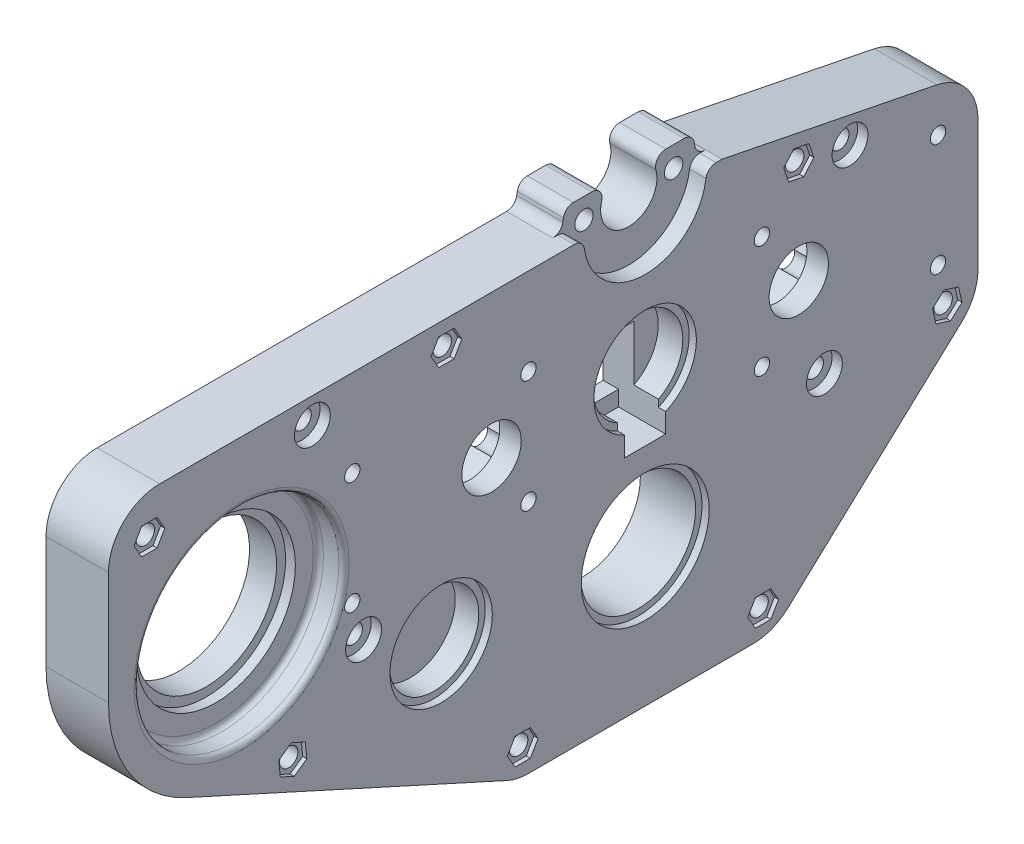
from build123d import *

# Parameters (mm, degrees)
SKETCH1_R             = 14.2875
SKETCH1_R_2           = 11.1125
SKETCH1_R_3           = 7.366
BOSS_EXTRUDE1_DEPTH   = 15.494
SKETCH2_R             = 15.875
SKETCH2_R_2           = 12.7
CUT_EXTRUDE1_DEPTH    = 1.778
CAVITY1_OUTLINE_R     = 7.366
CAVITY1_OUTLINE_R_2   = 4.445
CAVITY1_OUTLINE_R_3   = 1.143
CAVITY1_DEPTH         = 10.16
CAVITY1_START         = 10.16
CAVITY1_2_OUTLINE_R   = 4.445
CAVITY1_2_OUTLINE_R_2 = 1.143
CAVITY1_2_DEPTH       = 3.048
CAVITY1_START_2       = 12.192
CAVITY1_3_OUTLINE_R   = 1.905
CAVITY1_3_DEPTH       = 3.302
CAVITY1_4_DEPTH       = 1.778
CAVITY1_5_OUTLINE_R   = 2.286
CAVITY1_5_DEPTH       = 1.27
CAVITY1_START_3       = 13.208
CAVITY1_6_DEPTH       = 0.254
SKETCH3_R             = 11.1125
BOSS_EXTRUDE2_DEPTH   = 7.62
SKETCH5_R             = 15.24
CUT_EXTRUDE2_DEPTH    = 4.064
BOSS_EXTRUDE3_DEPTH   = 11.43
SKETCH7_R             = 2.286
SKETCH7_R_2           = 6.985
CUT_EXTRUDE3_DEPTH    = 115.652235041
FILLET1_R             = 2.54
FILLET2_R             = 2.54
CUT_EXTRUDE4_DEPTH    = 5.08
SKETCH9_R             = 17.4625
BOSS_EXTRUDE4_DEPTH   = 15.494
SKETCH11_R            = 19.685
CUT_EXTRUDE6_DEPTH    = 8.763
CUT_EXTRUDE7_DEPTH    = 156.43808204
SKETCH13_R            = 2.286
CUT_EXTRUDE8_DEPTH    = 156.43808204
CUT_EXTRUDE9_DEPTH    = 1.016
SKETCH15_R            = 4.445
CUT_EXTRUDE10_DEPTH   = 2.54
FILLET3_R             = 12.7
SKETCH17_R            = 25.4
CUT_EXTRUDE11_DEPTH   = 6.35
SKETCH18_R            = 11.1125
CUT_EXTRUDE12_DEPTH   = 7.62
SKETCH19_R            = 12.7
CUT_EXTRUDE13_DEPTH   = 1.778
FILLET4_R             = 1.27
SKETCH20_R            = 2.286
CUT_EXTRUDE14_DEPTH   = 156.43808204
SKETCH21_R            = 4.445
CUT_EXTRUDE15_DEPTH   = 2.54


# Read off the part's stored shape, not the designer's step: Cavity1
with BuildPart() as part:
    # Sketch1 → Boss-Extrude1 (new body)
    with BuildSketch(Plane(origin=(0, 0, 0), x_dir=(0, 0, -1), z_dir=(1, 0, 0))):
        Polygon((-82.55, 12.7), (-31.75, -34.29), (31.75, -34.29), (82.55, 12.7), (82.55, 73.66), (-82.55, 73.66), align=None)
        Circle(SKETCH1_R, mode=Mode.SUBTRACT)
        with Locations((0, 38.1)):
            Circle(SKETCH1_R_2, mode=Mode.SUBTRACT)
        with Locations((-38.1, 38.1)):
            Circle(SKETCH1_R_3, mode=Mode.SUBTRACT)
        with Locations(Location((38.1, 38.1, 0), (0, 0, 180))):
            Circle(SKETCH1_R_3, mode=Mode.SUBTRACT)
    extrude(amount=BOSS_EXTRUDE1_DEPTH)

    # Sketch2 → Cut-Extrude1 (cut)
    with BuildSketch(Plane(origin=(15.494, 0, 0), x_dir=(0, 0, -1), z_dir=(1, 0, 0))):
        Circle(SKETCH2_R)
        with Locations((0, 38.1)):
            Circle(SKETCH2_R_2)
    extrude(amount=-CUT_EXTRUDE1_DEPTH, mode=Mode.SUBTRACT)

    # Cavity1 outline → Cavity1 (cut)
    # profile 1 of 12: a face of its own
    with BuildSketch(Plane.YZ):
        with BuildLine():
            ThreePointArc((31.436494253, -50.810188518), (38.1, -52.451), (44.763505747, -50.810188518))
            ThreePointArc((44.763505747, -50.810188518), (48.336847552, -52.139105214), (48.164128852, -48.330567504))
            ThreePointArc((48.164128852, -48.330567504), (52.451, -38.1), (48.164128852, -27.869432496))
            ThreePointArc((48.164128852, -27.869432496), (48.336847552, -24.060894786), (44.763505747, -25.389811482))
            ThreePointArc((44.763505747, -25.389811482), (38.1, -23.749), (31.436494253, -25.389811482))
            ThreePointArc((31.436494253, -25.389811482), (27.863152448, -24.060894786), (28.035871148, -27.869432496))
            ThreePointArc((28.035871148, -27.869432496), (23.749, -38.1), (28.035871148, -48.330567504))
            ThreePointArc((28.035871148, -48.330567504), (27.863152448, -52.139105214), (31.436494253, -50.810188518))
        make_face()
        with Locations((38.1, -38.1)):
            Circle(CAVITY1_OUTLINE_R, mode=Mode.SUBTRACT)
    # profile 2 of 12: a face of its own
    with BuildSketch(Plane.YZ):
        with Locations((38.1, -63.5)):
            Circle(CAVITY1_OUTLINE_R_2)
    # profile 3 of 12: a face of its own
    with BuildSketch(Plane.YZ):
        with Locations((24.13, -72.644)):
            Circle(CAVITY1_OUTLINE_R_3)
    # profile 4 of 12: a face of its own
    with BuildSketch(Plane.YZ):
        with Locations((52.07, -72.644)):
            Circle(CAVITY1_OUTLINE_R_3)
    # profile 5 of 12: a face of its own
    with BuildSketch(Plane.YZ):
        with Locations((52.07, -28.956)):
            Circle(CAVITY1_OUTLINE_R_3)
    # profile 6 of 12: a face of its own
    with BuildSketch(Plane.YZ):
        with Locations((24.13, -28.956)):
            Circle(CAVITY1_OUTLINE_R_3)
    # profile 7 of 12: a face of its own
    with BuildSketch(Plane.YZ):
        with BuildLine():
            ThreePointArc((48.164128852, 27.869432496), (52.451, 38.1), (48.164128852, 48.330567504))
            ThreePointArc((48.164128852, 48.330567504), (48.336847552, 52.139105214), (44.763505747, 50.810188518))
            ThreePointArc((44.763505747, 50.810188518), (38.1, 52.451), (31.436494253, 50.810188518))
            ThreePointArc((31.436494253, 50.810188518), (27.863152448, 52.139105214), (28.035871148, 48.330567504))
            ThreePointArc((28.035871148, 48.330567504), (23.749, 38.1), (28.035871148, 27.869432496))
            ThreePointArc((28.035871148, 27.869432496), (27.863152448, 24.060894786), (31.436494253, 25.389811482))
            ThreePointArc((31.436494253, 25.389811482), (38.1, 23.749), (44.763505747, 25.389811482))
            ThreePointArc((44.763505747, 25.389811482), (48.336847552, 24.060894786), (48.164128852, 27.869432496))
        make_face()
        with Locations((38.1, 38.1)):
            Circle(CAVITY1_OUTLINE_R, mode=Mode.SUBTRACT)
    # profile 8 of 12: a face of its own
    with BuildSketch(Plane.YZ):
        with Locations((24.13, 28.956)):
            Circle(CAVITY1_OUTLINE_R_3)
    # profile 9 of 12: a face of its own
    with BuildSketch(Plane.YZ):
        with Locations((52.07, 28.956)):
            Circle(CAVITY1_OUTLINE_R_3)
    # profile 10 of 12: a face of its own
    with BuildSketch(Plane.YZ):
        with Locations((24.13, 72.644)):
            Circle(CAVITY1_OUTLINE_R_3)
    # profile 11 of 12: a face of its own
    with BuildSketch(Plane.YZ):
        with Locations((52.07, 72.644)):
            Circle(CAVITY1_OUTLINE_R_3)
    # profile 12 of 12: a face of its own
    with BuildSketch(Plane.YZ):
        with Locations((38.1, 63.5)):
            Circle(CAVITY1_OUTLINE_R_2)
    extrude(amount=CAVITY1_DEPTH, mode=Mode.SUBTRACT)

    # Cavity1 2 outline → Cavity1 2 (cut)
    with BuildSketch(Plane.YZ.offset(CAVITY1_START)):
        with BuildLine():
            ThreePointArc((41.72043784, -51.986815), (38.1, -46.99), (34.47956216, -51.986815))
            ThreePointArc((34.47956216, -51.986815), (38.1, -52.451), (41.72043784, -51.986815))
        make_face()
        with Locations((38.1, -63.5)):
            Circle(CAVITY1_2_OUTLINE_R)
        with Locations((24.13, -72.644)):
            Circle(CAVITY1_2_OUTLINE_R_2)
        with Locations((52.07, -72.644)):
            Circle(CAVITY1_2_OUTLINE_R_2)
        with Locations((52.07, -28.956)):
            Circle(CAVITY1_2_OUTLINE_R_2)
        with Locations((24.13, -28.956)):
            Circle(CAVITY1_2_OUTLINE_R_2)
        with Locations((24.13, 28.956)):
            Circle(CAVITY1_2_OUTLINE_R_2)
        with Locations((52.07, 28.956)):
            Circle(CAVITY1_2_OUTLINE_R_2)
        with Locations((24.13, 72.644)):
            Circle(CAVITY1_2_OUTLINE_R_2)
        with Locations((52.07, 72.644)):
            Circle(CAVITY1_2_OUTLINE_R_2)
        with BuildLine():
            ThreePointArc((41.72043784, 51.986815), (38.1, 52.451), (34.47956216, 51.986815))
            ThreePointArc((34.47956216, 51.986815), (38.1, 46.99), (41.72043784, 51.986815))
        make_face()
        with Locations((38.1, 63.5)):
            Circle(CAVITY1_2_OUTLINE_R)
    extrude(amount=CAVITY1_2_DEPTH, mode=Mode.SUBTRACT)

    # Cavity1 3 outline → Cavity1 3 (cut)
    with BuildSketch(Plane.YZ.offset(CAVITY1_START_2)):
        with Locations((24.13, -72.644)):
            Circle(CAVITY1_3_OUTLINE_R)
        with Locations((52.07, -72.644)):
            Circle(CAVITY1_3_OUTLINE_R)
        with Locations((52.07, -28.956)):
            Circle(CAVITY1_3_OUTLINE_R)
        with Locations((24.13, -28.956)):
            Circle(CAVITY1_3_OUTLINE_R)
        with Locations((24.13, 28.956)):
            Circle(CAVITY1_3_OUTLINE_R)
        with Locations((52.07, 28.956)):
            Circle(CAVITY1_3_OUTLINE_R)
        with Locations((24.13, 72.644)):
            Circle(CAVITY1_3_OUTLINE_R)
        with Locations((52.07, 72.644)):
            Circle(CAVITY1_3_OUTLINE_R)
    extrude(amount=CAVITY1_3_DEPTH, mode=Mode.SUBTRACT)

    # Cavity1 4 outline → Cavity1 4 (cut)
    with BuildSketch(Plane.YZ):
        with BuildLine():
            Line((36.854913564, -59.232941907), (36.838099029, -59.181648336))
            ThreePointArc((36.838099029, -59.181648336), (33.518956381, -61.00766679), (31.830238237, -64.398725966))
            Line((31.830238237, -64.398725966), (33.771487251, -62.489058668))
            ThreePointArc((33.771487251, -62.489058668), (34.872489185, -60.443662496), (36.854913564, -59.232941907))
        make_face()
        with BuildLine():
            ThreePointArc((37.196692174, -59.119577582), (37.016950842, -59.14804351), (36.838099029, -59.181648336))
            Line((36.838099029, -59.181648336), (36.854913564, -59.232941907))
            ThreePointArc((36.854913564, -59.232941907), (37.006864048, -59.191510846), (37.160186925, -59.155488936))
            Line((37.160186925, -59.155488936), (37.196692174, -59.119577582))
        make_face()
        with BuildLine():
            Line((39.345086436, -59.232941907), (39.361900971, -59.181648336))
            ThreePointArc((39.361900971, -59.181648336), (39.183049158, -59.14804351), (39.003307826, -59.119577582))
            Line((39.003307826, -59.119577582), (39.039813075, -59.155488936))
            ThreePointArc((39.039813075, -59.155488936), (39.193135952, -59.191510846), (39.345086436, -59.232941907))
        make_face()
        with BuildLine():
            ThreePointArc((44.369761763, -64.398725966), (42.681043619, -61.00766679), (39.361900971, -59.181648336))
            Line((39.361900971, -59.181648336), (39.345086436, -59.232941907))
            ThreePointArc((39.345086436, -59.232941907), (41.327510815, -60.443662496), (42.428512749, -62.489058668))
            Line((42.428512749, -62.489058668), (44.369761763, -64.398725966))
        make_face()
        with BuildLine():
            ThreePointArc((38.1, -59.055), (37.647193393, -59.071164971), (37.196692174, -59.119577582))
            Line((37.196692174, -59.119577582), (37.160186925, -59.155488936))
            ThreePointArc((37.160186925, -59.155488936), (37.627414917, -59.080193631), (38.1, -59.055))
        make_face()
        with BuildLine():
            Line((33.771487251, -62.489058668), (31.830238237, -64.398725966))
            ThreePointArc((31.830238237, -64.398725966), (32.494455949, -68.388349777), (35.432765737, -71.167669641))
            Line((35.432765737, -71.167669641), (36.57734666, -67.676068942))
            ThreePointArc((36.57734666, -67.676068942), (34.190357427, -65.6148806), (33.771487251, -62.489058668))
        make_face()
        with BuildLine():
            Line((39.039813075, -59.155488936), (39.003307826, -59.119577582))
            ThreePointArc((39.003307826, -59.119577582), (38.552806607, -59.071164971), (38.1, -59.055))
            ThreePointArc((38.1, -59.055), (38.572585083, -59.080193631), (39.039813075, -59.155488936))
        make_face()
        with BuildLine():
            ThreePointArc((44.45, -65.405), (44.429908656, -64.900266009), (44.369761763, -64.398725966))
            Line((44.369761763, -64.398725966), (42.428512749, -62.489058668))
            ThreePointArc((42.428512749, -62.489058668), (42.51578216, -62.991184794), (42.545, -63.5))
            ThreePointArc((42.545, -63.5), (41.741855234, -66.0485124), (39.62265334, -67.676068942))
            Line((39.62265334, -67.676068942), (40.767234263, -71.167669641))
            ThreePointArc((40.767234263, -71.167669641), (43.45067461, -68.824470897), (44.45, -65.405))
        make_face()
        with BuildLine():
            Line((36.57734666, -67.676068942), (35.432765737, -71.167669641))
            ThreePointArc((35.432765737, -71.167669641), (38.1, -71.755), (40.767234263, -71.167669641))
            Line((40.767234263, -71.167669641), (39.62265334, -67.676068942))
            ThreePointArc((39.62265334, -67.676068942), (38.1, -67.945), (36.57734666, -67.676068942))
        make_face()
        with BuildLine():
            Line((36.854913564, 59.232941907), (36.838099029, 59.181648336))
            ThreePointArc((36.838099029, 59.181648336), (37.016950842, 59.14804351), (37.196692174, 59.119577582))
            Line((37.196692174, 59.119577582), (37.160186925, 59.155488936))
            ThreePointArc((37.160186925, 59.155488936), (37.006864048, 59.191510846), (36.854913564, 59.232941907))
        make_face()
        with BuildLine():
            ThreePointArc((31.830238237, 64.398725966), (33.518956381, 61.00766679), (36.838099029, 59.181648336))
            Line((36.838099029, 59.181648336), (36.854913564, 59.232941907))
            ThreePointArc((36.854913564, 59.232941907), (34.872489185, 60.443662496), (33.771487251, 62.489058668))
            Line((33.771487251, 62.489058668), (31.830238237, 64.398725966))
        make_face()
        with BuildLine():
            ThreePointArc((35.432765737, 71.167669641), (32.494455949, 68.388349777), (31.830238237, 64.398725966))
            Line((31.830238237, 64.398725966), (33.771487251, 62.489058668))
            ThreePointArc((33.771487251, 62.489058668), (34.190357427, 65.6148806), (36.57734666, 67.676068942))
            Line((36.57734666, 67.676068942), (35.432765737, 71.167669641))
        make_face()
        with BuildLine():
            ThreePointArc((40.767234263, 71.167669641), (38.1, 71.755), (35.432765737, 71.167669641))
            Line((35.432765737, 71.167669641), (36.57734666, 67.676068942))
            ThreePointArc((36.57734666, 67.676068942), (38.1, 67.945), (39.62265334, 67.676068942))
            Line((39.62265334, 67.676068942), (40.767234263, 71.167669641))
        make_face()
        with BuildLine():
            Line((42.428512749, 62.489058668), (44.369761763, 64.398725966))
            ThreePointArc((44.369761763, 64.398725966), (44.429908656, 64.900266009), (44.45, 65.405))
            ThreePointArc((44.45, 65.405), (43.45067461, 68.824470897), (40.767234263, 71.167669641))
            Line((40.767234263, 71.167669641), (39.62265334, 67.676068942))
            ThreePointArc((39.62265334, 67.676068942), (41.741855234, 66.0485124), (42.545, 63.5))
            ThreePointArc((42.545, 63.5), (42.51578216, 62.991184794), (42.428512749, 62.489058668))
        make_face()
        with BuildLine():
            ThreePointArc((39.361900971, 59.181648336), (42.681043619, 61.00766679), (44.369761763, 64.398725966))
            Line((44.369761763, 64.398725966), (42.428512749, 62.489058668))
            ThreePointArc((42.428512749, 62.489058668), (41.327510815, 60.443662496), (39.345086436, 59.232941907))
            Line((39.345086436, 59.232941907), (39.361900971, 59.181648336))
        make_face()
        with BuildLine():
            Line((37.160186925, 59.155488936), (37.196692174, 59.119577582))
            ThreePointArc((37.196692174, 59.119577582), (37.647193393, 59.071164971), (38.1, 59.055))
            ThreePointArc((38.1, 59.055), (37.627414917, 59.080193631), (37.160186925, 59.155488936))
        make_face()
        with BuildLine():
            Line((39.039813075, 59.155488936), (39.003307826, 59.119577582))
            ThreePointArc((39.003307826, 59.119577582), (39.183049158, 59.14804351), (39.361900971, 59.181648336))
            Line((39.361900971, 59.181648336), (39.345086436, 59.232941907))
            ThreePointArc((39.345086436, 59.232941907), (39.193135952, 59.191510846), (39.039813075, 59.155488936))
        make_face()
        with BuildLine():
            ThreePointArc((38.1, 59.055), (38.552806607, 59.071164971), (39.003307826, 59.119577582))
            Line((39.003307826, 59.119577582), (39.039813075, 59.155488936))
            ThreePointArc((39.039813075, 59.155488936), (38.572585083, 59.080193631), (38.1, 59.055))
        make_face()
    extrude(amount=CAVITY1_4_DEPTH, mode=Mode.SUBTRACT)

    # Cavity1 5 outline → Cavity1 5 (cut)
    with BuildSketch(Plane.YZ.offset(CAVITY1_START)):
        with Locations((29.21, -50.292)):
            Circle(CAVITY1_5_OUTLINE_R)
        with Locations((46.99, -50.292)):
            Circle(CAVITY1_5_OUTLINE_R)
        with Locations((46.99, -25.908)):
            Circle(CAVITY1_5_OUTLINE_R)
        with Locations((29.21, -25.908)):
            Circle(CAVITY1_5_OUTLINE_R)
        with Locations((46.99, 25.908)):
            Circle(CAVITY1_5_OUTLINE_R)
        with Locations((29.21, 25.908)):
            Circle(CAVITY1_5_OUTLINE_R)
        with Locations((29.21, 50.292)):
            Circle(CAVITY1_5_OUTLINE_R)
        with Locations((46.99, 50.292)):
            Circle(CAVITY1_5_OUTLINE_R)
    extrude(amount=CAVITY1_5_DEPTH, mode=Mode.SUBTRACT)

    # Cavity1 6 outline → Cavity1 6 (cut)
    with BuildSketch(Plane.YZ.offset(CAVITY1_START_3)):
        with BuildLine():
            ThreePointArc((41.72043784, -51.986815), (38.1, -46.99), (34.47956216, -51.986815))
            ThreePointArc((34.47956216, -51.986815), (38.1, -52.451), (41.72043784, -51.986815))
        make_face()
        with BuildLine():
            ThreePointArc((41.72043784, 51.986815), (38.1, 52.451), (34.47956216, 51.986815))
            ThreePointArc((34.47956216, 51.986815), (38.1, 46.99), (41.72043784, 51.986815))
        make_face()
    extrude(amount=CAVITY1_6_DEPTH, mode=Mode.SUBTRACT)

    # Sketch3 → Boss-Extrude2 (add)
    with BuildSketch(Plane.ZY):
        with Locations((0, 38.1)):
            Circle(SKETCH3_R)
    extrude(amount=-BOSS_EXTRUDE2_DEPTH)

    # Sketch5 → Cut-Extrude2 (cut)
    with BuildSketch(Plane(origin=(15.494, 0, 0), x_dir=(0, 0, -1), z_dir=(1, 0, 0))):
        with Locations((0, 73.66)):
            Circle(SKETCH5_R)
    extrude(amount=-CUT_EXTRUDE2_DEPTH, mode=Mode.SUBTRACT)

    # Sketch6 → Boss-Extrude3 (add)
    with BuildSketch(Plane(origin=(11.43, 0, 0), x_dir=(0, 0, -1), z_dir=(1, 0, 0))):
        with BuildLine():
            Line((15.709032434, 78.74), (-15.709032434, 78.74))
            ThreePointArc((-15.709032434, 78.74), (0, 57.15), (15.709032434, 78.74))
        make_face()
    extrude(amount=-BOSS_EXTRUDE3_DEPTH)

    # Sketch7 → Cut-Extrude3 (cut, through all)
    with BuildSketch(Plane(origin=(11.43, 0, 0), x_dir=(0, 0, -1), z_dir=(1, 0, 0))):
        with Locations((-11.1125, 73.66)):
            Circle(SKETCH7_R)
        with Locations((11.1125, 73.66)):
            Circle(SKETCH7_R)
        with Locations((0, 73.66)):
            Circle(SKETCH7_R_2)
    extrude(amount=-CUT_EXTRUDE3_DEPTH, mode=Mode.SUBTRACT)

    # Fillet1
    fillet1_edges = [part.edges().sort_by_distance(p)[0] for p in [
        (5.715, 73.66, 16.51),
        (5.715, 73.66, -16.51),
        (5.715, 78.74, -15.709032434),
        (5.715, 78.74, 15.709032434),
        (5.715, 78.74, -4.794144866),
        (5.715, 78.74, 4.794144866),
    ]]
    fillet(fillet1_edges, radius=FILLET1_R)

    # Fillet2
    fillet2_edges = [part.edges().sort_by_distance(p)[0] for p in [
        (13.462, 73.66, 15.24),
        (13.462, 73.66, -15.24),
    ]]
    fillet(fillet2_edges, radius=FILLET2_R)

    # Sketch8 → Cut-Extrude4 (cut, symmetric)
    with BuildSketch(Plane(origin=(0, 0, 0), x_dir=(-1, 0, 0), z_dir=(0, 0, -1))):
        Polygon((0, 38.1), (0, 25.4), (-3.81, 25.4), (-3.81, 21.59), (-15.494, 21.59), (-15.494, 41.91), (-3.81, 41.91), (-3.81, 38.1), align=None)
    extrude(amount=CUT_EXTRUDE4_DEPTH, both=True, mode=Mode.SUBTRACT)

    # Sketch9 → Boss-Extrude4 (add)
    with BuildSketch(Plane.ZY):
        with BuildLine():
            Line((82.55, 12.7), (31.75, -34.29))
            Line((31.75, -34.29), (113.749594721, 2.935750618))
            ThreePointArc((113.749594721, 2.935750618), (127.858181968, 15.119388608), (133.120042489, 33.002511732))
            Line((133.120042489, 33.002511732), (133.120042489, 73.66))
            Line((133.120042489, 73.66), (82.55, 73.66))
            Line((82.55, 73.66), (82.55, 12.7))
        make_face()
        with Locations((100.100042489, 33.002511732)):
            Circle(SKETCH9_R, mode=Mode.SUBTRACT)
    extrude(amount=-BOSS_EXTRUDE4_DEPTH)

    # Sketch11 → Cut-Extrude6 (cut)
    with BuildSketch(Plane(origin=(15.494, 0, 0), x_dir=(0, 0, -1), z_dir=(1, 0, 0))):
        with Locations((-100.100042489, 33.002511732)):
            Circle(SKETCH11_R)
    extrude(amount=-CUT_EXTRUDE6_DEPTH, mode=Mode.SUBTRACT)

    # Sketch12 → Cut-Extrude7 (cut, through all)
    with BuildSketch(Plane.ZY):
        Polygon((-82.55, 73.66), (-82.55, 60.96), (-19.05, 73.66), align=None)
    extrude(amount=-CUT_EXTRUDE7_DEPTH, mode=Mode.SUBTRACT)

    # Sketch13 → Cut-Extrude8 (cut, through all)
    with BuildSketch(Plane(origin=(15.494, 0, 0), x_dir=(0, 0, -1), z_dir=(1, 0, 0))):
        with Locations((-49.300042489, 67.31)):
            Circle(SKETCH13_R)
        with Locations((38.1, 63.374245218)):
            Circle(SKETCH13_R)
        with Locations((74.93, 14.301554281)):
            Circle(SKETCH13_R)
        with Locations((29.263454831, -27.94)):
            Circle(SKETCH13_R)
        with Locations((-30.376103874, -27.94)):
            Circle(SKETCH13_R)
        with Locations((-87.400042489, -2.052568174)):
            Circle(SKETCH13_R)
        with Locations((-122.960042489, 63.5)):
            Circle(SKETCH13_R)
    extrude(amount=-CUT_EXTRUDE8_DEPTH, mode=Mode.SUBTRACT)

    # Sketch14 → Cut-Extrude9 (cut)
    with BuildSketch(Plane(origin=(15.494, 0, 0), x_dir=(0, 0, -1), z_dir=(1, 0, 0))):
        Polygon((-45.487221312, 67.31), (-47.3936319, 70.612), (-51.206453078, 70.612), (-53.112863667, 67.31), (-51.206453078, 64.008), (-47.3936319, 64.008), align=None)
        Polygon((41.838778767, 62.626489464), (40.616964862, 66.238244732), (36.878186095, 66.986000486), (34.361221233, 64.122000971), (35.583035138, 60.510245703), (39.321813905, 59.76248995), align=None)
        Polygon((77.72898989, 16.890619929), (74.087298322, 18.020083454), (71.288308432, 15.431017806), (72.13101011, 11.712488633), (75.772701678, 10.583025107), (78.571691568, 13.172090755), align=None)
        Polygon((31.16986542, -24.638), (27.357044243, -24.638), (25.450633654, -27.94), (27.357044243, -31.242), (31.16986542, -31.242), (33.076276009, -27.94), align=None)
        Polygon((-26.563282697, -27.94), (-28.469693286, -24.638), (-32.282514463, -24.638), (-34.188925052, -27.94), (-32.282514463, -31.242), (-28.469693286, -31.242), align=None)
        Polygon((-83.928231965, -3.628682705), (-84.299182004, 0.166050672), (-87.770992528, 1.742165203), (-90.871853014, -0.476453643), (-90.500902975, -4.27118702), (-87.02909245, -5.847301551), align=None)
        Polygon((-119.147224029, 63.495448117), (-121.049691212, 66.799721705), (-124.862509673, 66.804273589), (-126.77286095, 63.504551883), (-124.870393766, 60.200278295), (-121.057575306, 60.195726411), align=None)
    extrude(amount=-CUT_EXTRUDE9_DEPTH, mode=Mode.SUBTRACT)

    # Sketch15 → Cut-Extrude10 (cut)
    with BuildSketch(Plane.ZY):
        with Locations((-38.1, 63.374245218)):
            Circle(SKETCH15_R)
        with Locations((-74.93, 14.301554281)):
            Circle(SKETCH15_R)
        with Locations((-29.263454831, -27.94)):
            Circle(SKETCH15_R)
        with Locations((30.376103874, -27.94)):
            Circle(SKETCH15_R)
        with Locations((87.400042489, -2.052568174)):
            Circle(SKETCH15_R)
        with Locations((49.300042489, 67.31)):
            Circle(SKETCH15_R)
        with Locations((122.960042489, 63.5)):
            Circle(SKETCH15_R)
    extrude(amount=-CUT_EXTRUDE10_DEPTH, mode=Mode.SUBTRACT)

    # Fillet3
    fillet3_edges = [part.edges().sort_by_distance(p)[0] for p in [
        (7.747, 12.7, -82.55),
        (7.747, -34.29, -31.75),
        (7.747, -34.29, 31.75),
        (7.747, 73.66, 133.120042489),
        (7.747, 60.96, -82.55),
    ]]
    fillet(fillet3_edges, radius=FILLET3_R)

    # Sketch17 → Cut-Extrude11 (cut)
    with BuildSketch(Plane(origin=(15.494, 0, 0), x_dir=(0, 0, -1), z_dir=(1, 0, 0))):
        with Locations((-100.100042489, 33.002511732)):
            Circle(SKETCH17_R)
    extrude(amount=-CUT_EXTRUDE11_DEPTH, mode=Mode.SUBTRACT)

    # Sketch18 → Cut-Extrude12 (cut)
    with BuildSketch(Plane(origin=(15.494, 0, 0), x_dir=(0, 0, -1), z_dir=(1, 0, 0))):
        with Locations((-50.606690663, 4.427511732)):
            Circle(SKETCH18_R)
    extrude(amount=-CUT_EXTRUDE12_DEPTH, mode=Mode.SUBTRACT)

    # Sketch19 → Cut-Extrude13 (cut)
    with BuildSketch(Plane(origin=(15.494, 0, 0), x_dir=(0, 0, -1), z_dir=(1, 0, 0))):
        with Locations((-50.606690663, 4.427511732)):
            Circle(SKETCH19_R)
    extrude(amount=-CUT_EXTRUDE13_DEPTH, mode=Mode.SUBTRACT)

    # Fillet4
    fillet4_edges = [part.edges().sort_by_distance(p)[0] for p in [
        (15.494, 33.002511732, 125.500042489),
        (9.144, 33.002511732, 125.500042489),
    ]]
    fillet(fillet4_edges, radius=FILLET4_R)

    # Sketch20 → Cut-Extrude14 (cut, through all)
    with BuildSketch(Plane.ZY):
        with Locations((-44.45, 14.929743531)):
            Circle(SKETCH20_R)
        with Locations((-50.8, 60.834245218)):
            Circle(SKETCH20_R)
        with Locations((82.55, 67.31)):
            Circle(SKETCH20_R)
        with Locations((69.85, 14.929743531)):
            Circle(SKETCH20_R)
    extrude(amount=-CUT_EXTRUDE14_DEPTH, mode=Mode.SUBTRACT)

    # Sketch21 → Cut-Extrude15 (cut)
    with BuildSketch(Plane(origin=(15.494, 0, 0), x_dir=(0, 0, -1), z_dir=(1, 0, 0))):
        with Locations((-82.55, 67.31)):
            Circle(SKETCH21_R)
        with Locations((-69.85, 14.929743531)):
            Circle(SKETCH21_R)
        with Locations((44.45, 14.929743531)):
            Circle(SKETCH21_R)
        with Locations((50.8, 60.834245218)):
            Circle(SKETCH21_R)
    extrude(amount=-CUT_EXTRUDE15_DEPTH, mode=Mode.SUBTRACT)


solid = part.part
